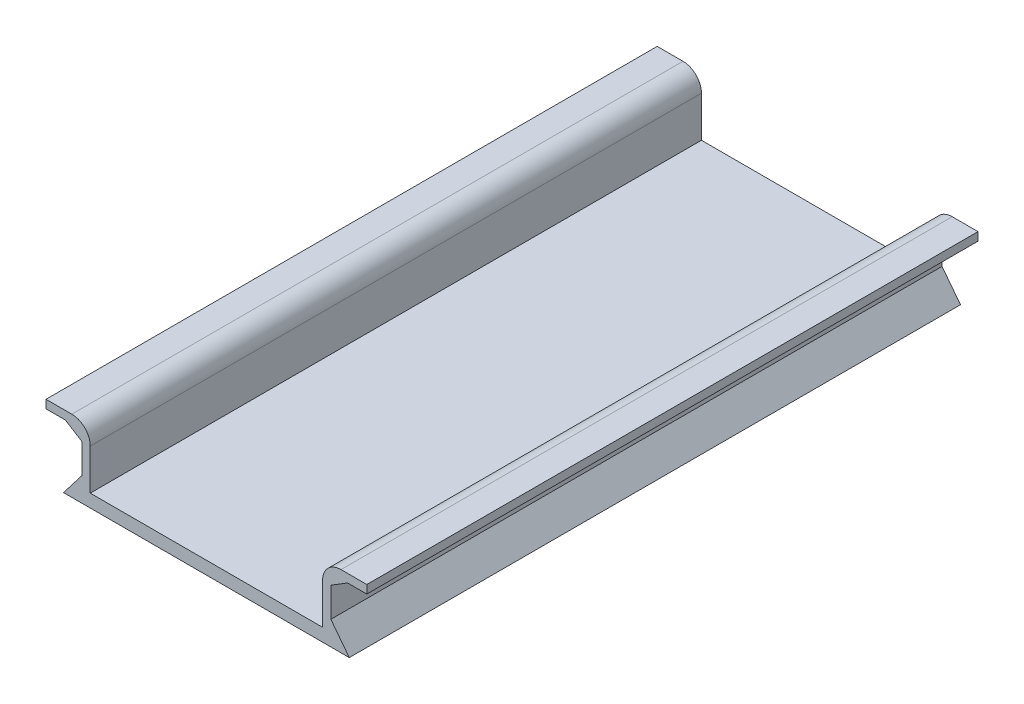
from build123d import *

# Parameters (mm, degrees)
BOSS_EXTRUDE1_DEPTH = 66.3


with BuildPart() as part:
    # Sketch1 → Boss-Extrude1 (new body)
    with BuildSketch(Plane.XY):
        with BuildLine():
            Line((-15.5, 0), (15.5, 0))
            Line((15.5, 0), (13.5, 2.6))
            Line((13.5, 2.6), (13.5, 5.8))
            Line((13.5, 5.8), (15.3, 6.92))
            Line((15.3, 6.92), (17.4, 6.92))
            Line((17.4, 6.92), (17.4, 7.82))
            Line((17.4, 7.82), (14.6, 7.82))
            ThreePointArc((14.6, 7.82), (13.185786438, 7.234213562), (12.6, 5.82))
            Line((12.6, 5.82), (12.6, 1.4))
            Line((12.6, 1.4), (-12.6, 1.4))
            Line((-12.6, 1.4), (-12.6, 5.82))
            ThreePointArc((-12.6, 5.82), (-13.185786438, 7.234213562), (-14.6, 7.82))
            Line((-14.6, 7.82), (-17.4, 7.82))
            Line((-17.4, 7.82), (-17.4, 6.92))
            Line((-17.4, 6.92), (-15.3, 6.92))
            Line((-15.3, 6.92), (-13.5, 5.8))
            Line((-13.5, 5.8), (-13.5, 2.6))
            Line((-13.5, 2.6), (-15.5, 0))
        make_face()
    extrude(amount=BOSS_EXTRUDE1_DEPTH)


solid = part.part
